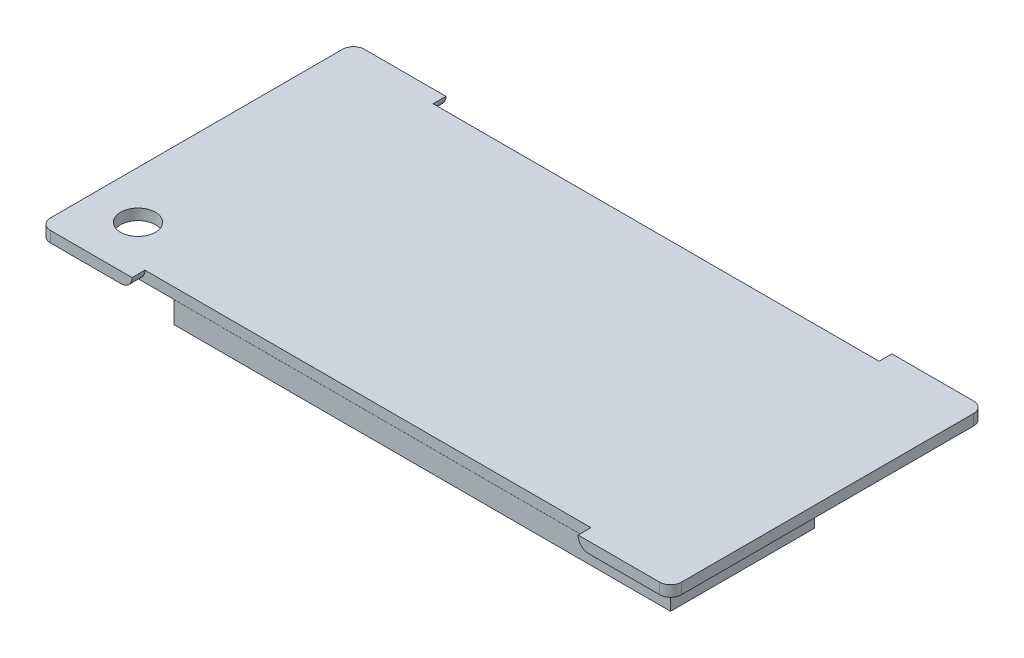
from build123d import *

# Parameters (mm, degrees)
BOSS_EXTRUDE10_DEPTH = 1
BOSS_EXTRUDE11_DEPTH = 2
FILLET1_R            = 1
SKETCH22_R           = 1.6
CUT_EXTRUDE1_DEPTH   = 10


with BuildPart() as part:
    # Sketch20 → Boss-Extrude10 (new body)
    with BuildSketch(Plane(origin=(0, 0, 0), x_dir=(1, 0, 0), z_dir=(0, 1, 0))):
        with BuildLine():
            Line((-28, 14.425), (-20.5, 14.425))
            Line((-20.5, 14.425), (-20.5, 13.245))
            Line((-20.5, 13.245), (20.5, 13.245))
            Line((20.5, 13.245), (20.5, 14.425))
            Line((20.5, 14.425), (28, 14.425))
            ThreePointArc((28, 14.425), (28.707106781, 14.132106781), (29, 13.425))
            Line((29, 13.425), (29, -13.425))
            ThreePointArc((29, -13.425), (28.707106781, -14.132106781), (28, -14.425))
            Line((28, -14.425), (20.5, -14.425))
            Line((20.5, -14.425), (20.5, -13.245))
            Line((20.5, -13.245), (-20.5, -13.245))
            Line((-20.5, -13.245), (-20.5, -14.425))
            Line((-20.5, -14.425), (-28, -14.425))
            ThreePointArc((-28, -14.425), (-28.707106781, -14.132106781), (-29, -13.425))
            Line((-29, -13.425), (-29, 13.425))
            ThreePointArc((-29, 13.425), (-28.707106781, 14.132106781), (-28, 14.425))
        make_face()
    extrude(amount=BOSS_EXTRUDE10_DEPTH)

    # Sketch21 → Boss-Extrude11 (add)
    with BuildSketch(Plane.XZ):
        Polygon((-27.825, 3.25), (-26.825, 3.25), (-26.825, -12.25), (16.5, -12.25), (16.5, -13.25), (-27.825, -13.25), align=None)
        Polygon((-17.825, 13.25), (-17.825, 12.25), (26.825, 12.25), (26.825, 0), (27.825, 0), (27.825, 13.25), align=None)
    extrude(amount=BOSS_EXTRUDE11_DEPTH)

    # Fillet1
    fillet1_edges = [part.edges().sort_by_distance(p)[0] for p in [
        (-20.5, 0, -13.8375),
        (20.5, 0, -13.835),
        (20.5, 0, 13.8375),
        (-20.5, 0, 13.835),
    ]]
    fillet(fillet1_edges, radius=FILLET1_R - 0.0001)  # a hair under: the kernel refuses the full size

    # Sketch22 → Cut-Extrude1 (cut)
    with BuildSketch(Plane.XZ):
        with Locations(Location((-24.627459856, 9.750471763, 0), (0, 0, 270))):
            Circle(SKETCH22_R)
    extrude(amount=-CUT_EXTRUDE1_DEPTH, mode=Mode.SUBTRACT)


solid = part.part
